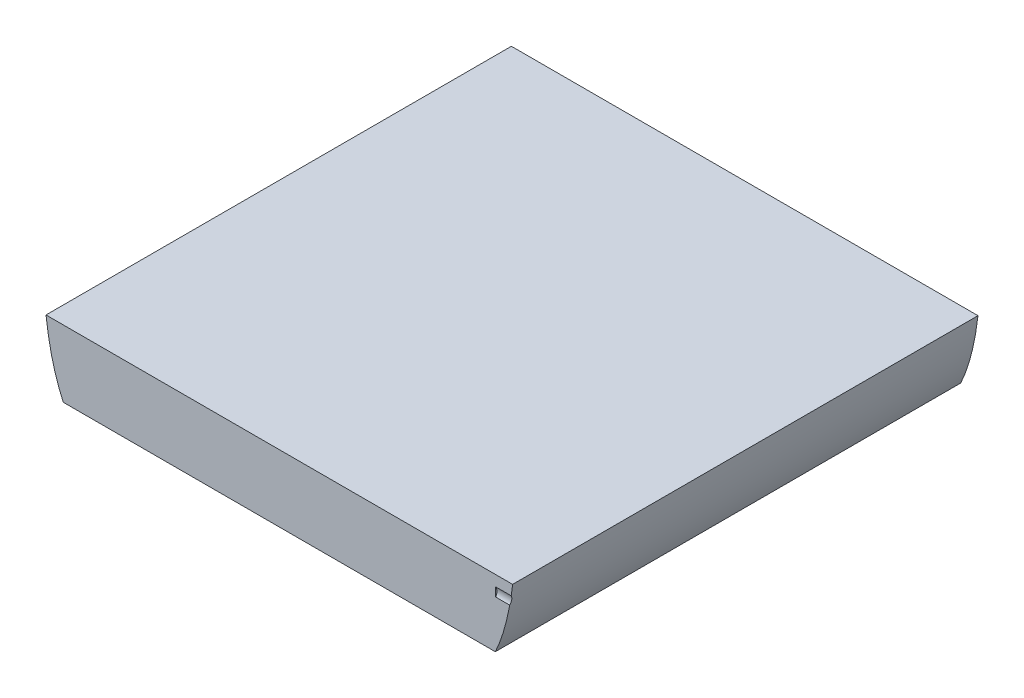
from build123d import *

# Parameters (mm, degrees)
BOSS_EXTRUDE1_DEPTH      = 349.25
BOSS_EXTRUDE1_DEPTH_BACK = 349.25
SKETCH44_R               = 12.7
CUT_EXTRUDE1_DEPTH       = 25.4
SPLIT1_SURFACE_1_BACK    = 1014.913
SPLIT1_SURFACE_1_DEPTH   = 2029.826


with BuildPart() as part:
    # Sketch1 → Boss-Extrude1 (new, two sides: drawn at the far end of the back side and taken through both)
    with BuildSketch(Plane.XY.offset(-BOSS_EXTRUDE1_DEPTH_BACK)):
        with BuildLine():
            Line((-350.176916026, 222.758), (0, 222.758))
            Line((0, 222.758), (350.176916026, 222.758))
            add(Edge.make_bspline(
                [(350.176916026, 222.758), (323.602122165, 0), (0, 0)],
                knots=[0, 0, 0, 1, 1, 1], degree=2, weights=[1, 1.328097491, 1]))
            add(Edge.make_bspline(
                [(-350.176916026, 222.758), (-323.602122165, 0), (0, 0)],
                knots=[0, 0, 0, 1, 1, 1], degree=2, weights=[1, 1.328097491, 1]))
        make_face()
    extrude(amount=BOSS_EXTRUDE1_DEPTH + BOSS_EXTRUDE1_DEPTH_BACK)

    # Sketch44 → Cut-Extrude1 (cut)
    with BuildSketch(Plane(origin=(350.176916026, 0, 0), x_dir=(0, 0, -1), z_dir=(1, 0, 0))):
        with Locations((-360.084219874, 200.172525694)):
            Circle(SKETCH44_R)
    extrude(amount=-CUT_EXTRUDE1_DEPTH, mode=Mode.SUBTRACT)

    # Split1: cut with a surface, the side it looks to stays
    # Split1 surface: a surface, the sketch's curves swept straight by 2029.826 mm
    with BuildLine(Plane.XY.offset(-SPLIT1_SURFACE_1_BACK), mode=Mode.PRIVATE) as split1_surface_1_path:
        Line((-363.688822472, 122.174), (403.145628683, 122.174))
    split1_surface_1 = Shell.extrude(split1_surface_1_path.wire(), (0 * SPLIT1_SURFACE_1_DEPTH, 0 * SPLIT1_SURFACE_1_DEPTH, 1 * SPLIT1_SURFACE_1_DEPTH))
    split(bisect_by=split1_surface_1, keep=Keep.TOP)


solid = part.part
